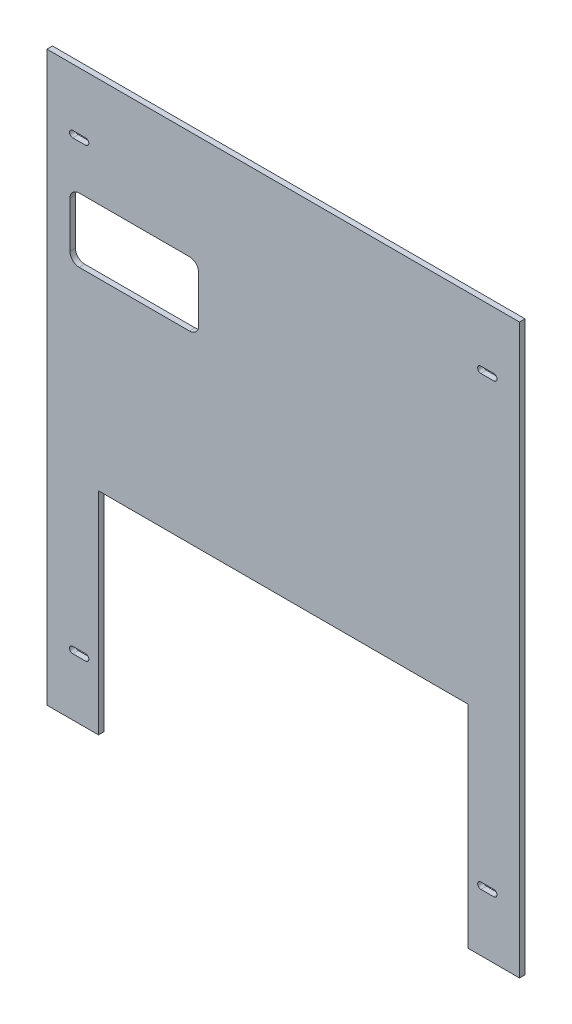
from build123d import *

# Parameters (mm, degrees)
ESQUISSE1_W             = 257
ESQUISSE1_H             = 309
BOSS_EXTRU_1_DEPTH      = 3
ESQUISSE2_W             = 201
ESQUISSE2_H             = 115
ENL_V_MAT_EXTRU_1_DEPTH = 201.97636677
ENL_V_MAT_EXTRU_2_DEPTH = 201.97636677


with BuildPart() as part:
    # Esquisse1 → Boss.-Extru.1 (new body)
    with BuildSketch(Plane.XY):
        Rectangle(ESQUISSE1_W, ESQUISSE1_H)
        with BuildLine():
            Line((-114.5, 123.25), (-107.5, 123.25))
            ThreePointArc((-107.5, 123.25), (-105.75, 121.5), (-107.5, 119.75))
            Line((-107.5, 119.75), (-114.5, 119.75))
            ThreePointArc((-114.5, 119.75), (-116.25, 121.5), (-114.5, 123.25))
        make_face(mode=Mode.SUBTRACT)
        with BuildLine():
            Line((107.5, -119.75), (114.5, -119.75))
            ThreePointArc((114.5, -119.75), (116.25, -121.5), (114.5, -123.25))
            Line((114.5, -123.25), (107.5, -123.25))
            ThreePointArc((107.5, -123.25), (105.75, -121.5), (107.5, -119.75))
        make_face(mode=Mode.SUBTRACT)
        with BuildLine():
            Line((-114.5, -119.75), (-107.5, -119.75))
            ThreePointArc((-107.5, -119.75), (-105.75, -121.5), (-107.5, -123.25))
            Line((-107.5, -123.25), (-114.5, -123.25))
            ThreePointArc((-114.5, -123.25), (-116.25, -121.5), (-114.5, -119.75))
        make_face(mode=Mode.SUBTRACT)
        with BuildLine():
            Line((107.5, 123.25), (114.5, 123.25))
            ThreePointArc((114.5, 123.25), (116.25, 121.5), (114.5, 119.75))
            Line((114.5, 119.75), (107.5, 119.75))
            ThreePointArc((107.5, 119.75), (105.75, 121.5), (107.5, 123.25))
        make_face(mode=Mode.SUBTRACT)
    extrude(amount=BOSS_EXTRU_1_DEPTH)

    # Esquisse2 → Enlèv. mat.-Extru.1 (cut, through all)
    with BuildSketch(Plane.XY.offset(3)):
        with Locations((0, -97)):
            Rectangle(ESQUISSE2_W, ESQUISSE2_H)
    extrude(amount=-ENL_V_MAT_EXTRU_1_DEPTH, mode=Mode.SUBTRACT)

    # Esquisse3 → Enlèv. mat.-Extru.2 (cut, through all)
    with BuildSketch(Plane.XY.offset(3)):
        with BuildLine():
            Line((-111, 60.5), (-51, 60.5))
            ThreePointArc((-51, 60.5), (-47.464466094, 61.964466094), (-46, 65.5))
            Line((-46, 65.5), (-46, 90.5))
            ThreePointArc((-46, 90.5), (-47.464466094, 94.035533906), (-51, 95.5))
            Line((-51, 95.5), (-111, 95.5))
            ThreePointArc((-111, 95.5), (-114.535533906, 94.035533906), (-116, 90.5))
            Line((-116, 90.5), (-116, 65.5))
            ThreePointArc((-116, 65.5), (-114.535533906, 61.964466094), (-111, 60.5))
        make_face()
    extrude(amount=-ENL_V_MAT_EXTRU_2_DEPTH, mode=Mode.SUBTRACT)


solid = part.part
